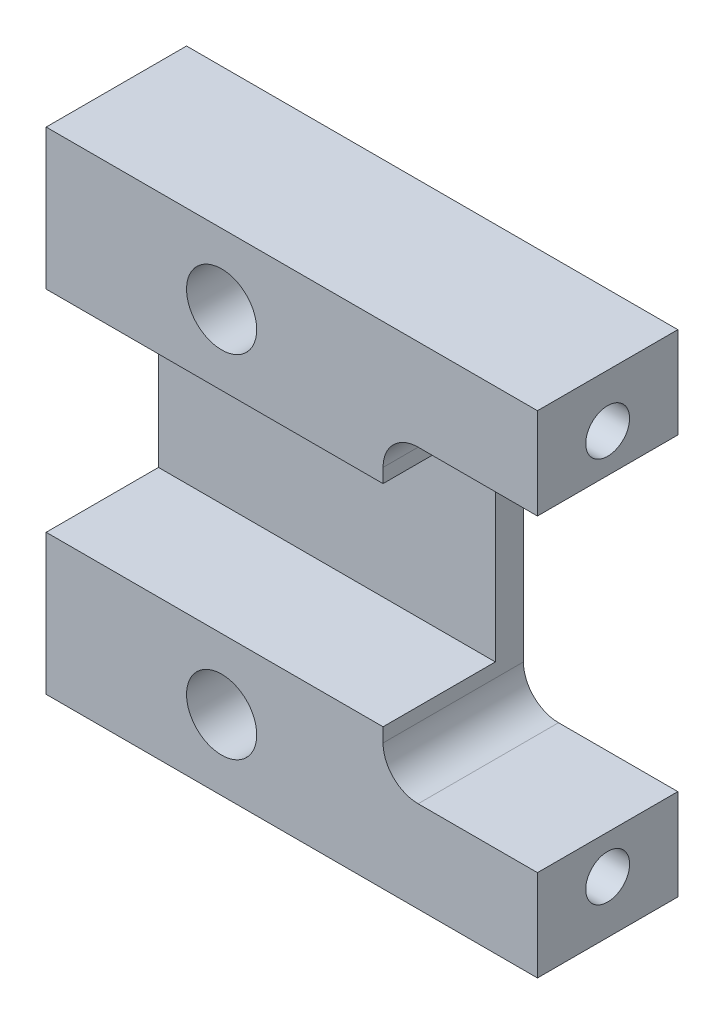
from build123d import *

# Parameters (mm, degrees)
SKETCH1_W                  = 88.9
SKETCH1_H                  = 88.9
EXTRUDE1_DEPTH             = 25.4
F_1_2_0_5_DIAMETER_HOLE1_D = 12.7
EXTRUDE5_DEPTH             = 20.32
SKETCH16_W                 = 27.94
SKETCH16_H                 = 55.88
EXTRUDE6_DEPTH             = 67.064418562
FILLET2_R                  = 6.35


with BuildPart() as part:
    # Sketch1 → Extrude1 (new body)
    with BuildSketch(Plane.XY):
        Rectangle(SKETCH1_W, SKETCH1_H)
    extrude(amount=EXTRUDE1_DEPTH)

    # Sketch3 → Tap Drill for 3/8-16 Tap2 (revolve, cut)
    with BuildSketch(Plane(origin=(44.45, 34.925, 12.7), x_dir=(0, 0, -1), z_dir=(0, 1, 0))):
        Polygon((0, 0), (0, 20.164665582), (3.96875, 17.78), (3.96875, 0), align=None)
    tap_drill_for_3_8_16_tap2 = revolve(axis=Axis((50.8, 34.925, 12.7), (-1, 0, 0)), mode=Mode.SUBTRACT)

    # Mirror1: Tap Drill for 3/8-16 Tap2 across plane
    add(tap_drill_for_3_8_16_tap2.mirror(Plane.ZX), mode=Mode.SUBTRACT)

    # 1/2 (0.5) Diameter Hole1 (through all)
    with Locations(Plane.XY.offset(25.4)):
        with Locations((-12.7, 31.75)):
            f_1_2_0_5_diameter_hole1 = Hole(F_1_2_0_5_DIAMETER_HOLE1_D / 2)

    # Mirror3: 1/2 (0.5) Diameter Hole1 across plane
    add(f_1_2_0_5_diameter_hole1.mirror(Plane.ZX), mode=Mode.SUBTRACT)

    # Sketch15 → Extrude5 (cut)
    with BuildSketch(Plane.XY.offset(25.4)):
        Polygon((-44.45, 0), (-44.45, 19.05), (16.51, 19.05), (16.51, 27.94), (44.45, 27.94), (44.45, 0), align=None)
    extrude5 = extrude(amount=-EXTRUDE5_DEPTH, mode=Mode.SUBTRACT)

    # Mirror4: Extrude5 across plane
    add(extrude5.mirror(Plane.ZX), mode=Mode.SUBTRACT)

    # Sketch16 → Extrude6 (cut, through all)
    with BuildSketch(Plane.XY.offset(5.08)):
        with Locations((30.48, 0)):
            Rectangle(SKETCH16_W, SKETCH16_H)
    extrude(amount=-EXTRUDE6_DEPTH, mode=Mode.SUBTRACT)

    # Fillet2
    fillet2_edges = [part.edges().sort_by_distance(p)[0] for p in [
        (16.51, -27.94, 12.7),
        (16.51, 27.94, 12.7),
    ]]
    fillet(fillet2_edges, radius=FILLET2_R)

    # Sketch18 → Tap Drill for 1/2-13 Tap2 (revolve, cut)
    with BuildSketch(Plane(origin=(-44.45, 31.75, 12.7), x_dir=(0, 0, 1), z_dir=(0, 1, 0))):
        Polygon((0, 0), (0, 20.999489309), (5.35813, 17.78), (5.35813, 0), align=None)
    tap_drill_for_1_2_13_tap2 = revolve(axis=Axis((-50.8, 31.75, 12.7), (1, 0, 0)), mode=Mode.SUBTRACT)

    # Mirror5: Tap Drill for 1/2-13 Tap2 across plane
    add(tap_drill_for_1_2_13_tap2.mirror(Plane.ZX), mode=Mode.SUBTRACT)


solid = part.part
